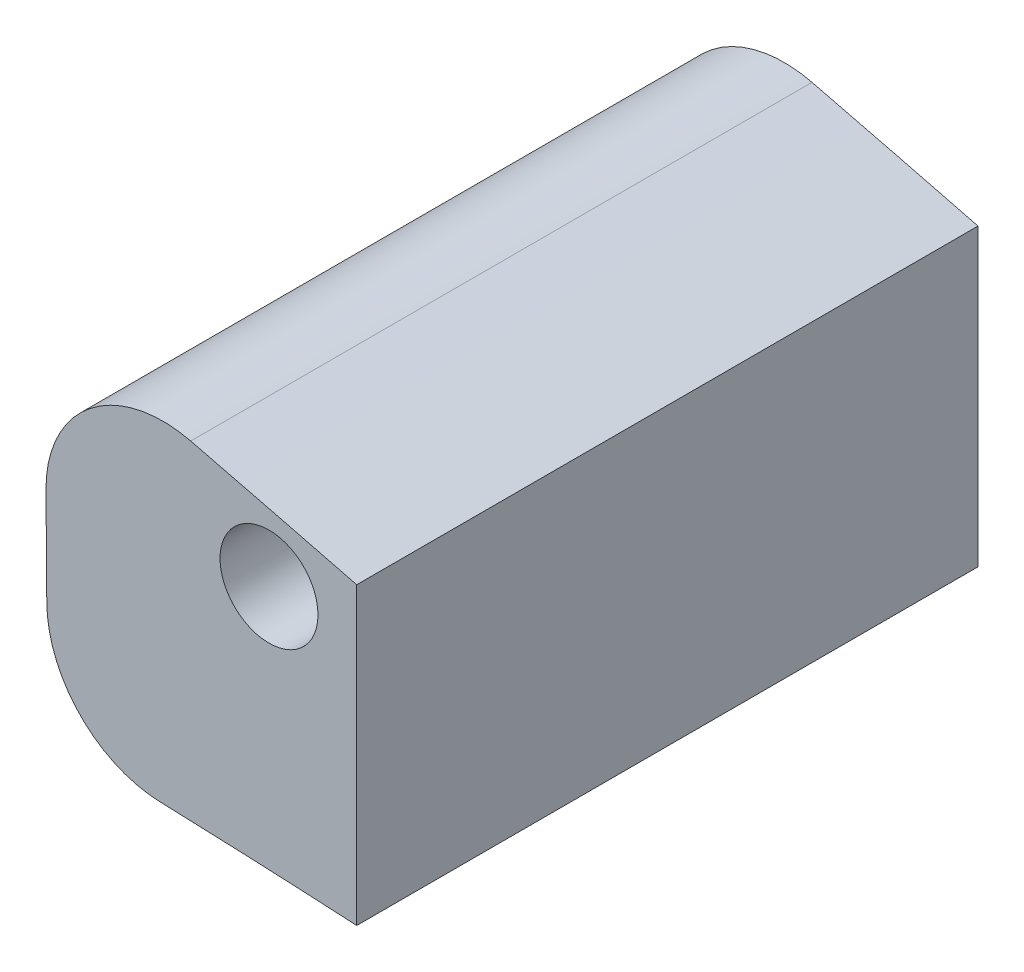
from build123d import *

# Parameters (mm, degrees)
SKETCH1_R           = 2.127
BOSS_EXTRUDE1_DEPTH = 26.9875
SKETCH2_W           = 67.08406667
SKETCH2_H           = 34.814742066
CUT_EXTRUDE1_DEPTH  = 49.976949102


with BuildPart() as part:
    # Sketch1 → Boss-Extrude1 (new body)
    with BuildSketch(Plane.XY):
        with BuildLine():
            Line((-30.400182319, 5.468298251), (-30.365973653, 1.240425986))
            ThreePointArc((-30.365973653, 1.240425986), (-28.924595391, -2.263615358), (-25.459175839, -3.79552409))
            add(Edge.make_bspline(
                [(-25.459175839, -3.79552409), (-20.440796041, -3.966560327), (-12.727099819, -4.359712886), (0.907959388, -5.579311451), (12.523213564, -6.173725196), (25.885633761, -7.888162402), (33.395018609, -8.29664003), (37.838880716, -9.368304898)],
                knots=[0, 0, 0, 0, 0.159192827, 0.24490199, 0.434077088, 0.527702347, 0.67202474, 0.67202474, 0.67202474, 0.67202474], degree=3))
            add(Edge.make_bspline(
                [(37.838880716, -9.368304898), (41.584970817, -9.726817262), (31.356665703, -6.120427202), (23.110253494, -2.926326877), (1.540704829, 3.859937245), (-14.437853355, 8.076932108), (-24.113185271, 10.443886796)],
                knots=[0.330745029, 0.330745029, 0.330745029, 0.330745029, 0.390659553, 0.50653142, 0.700019719, 1, 1, 1, 1], degree=3))
            ThreePointArc((-24.113185271, 10.443886796), (-28.472889532, 9.492851805), (-30.400182319, 5.468298251))
        make_face()
        with Locations((-20.712788813, 6.668480795)):
            Circle(SKETCH1_R, mode=Mode.SUBTRACT)
    extrude(amount=BOSS_EXTRUDE1_DEPTH)

    # Sketch2 → Cut-Extrude1 (cut, through all)
    with BuildSketch(Plane.XY.offset(26.9875)):
        with Locations((16.639244522, -3.276083686)):
            Rectangle(SKETCH2_W, SKETCH2_H)
    extrude(amount=-CUT_EXTRUDE1_DEPTH, mode=Mode.SUBTRACT)


solid = part.part
